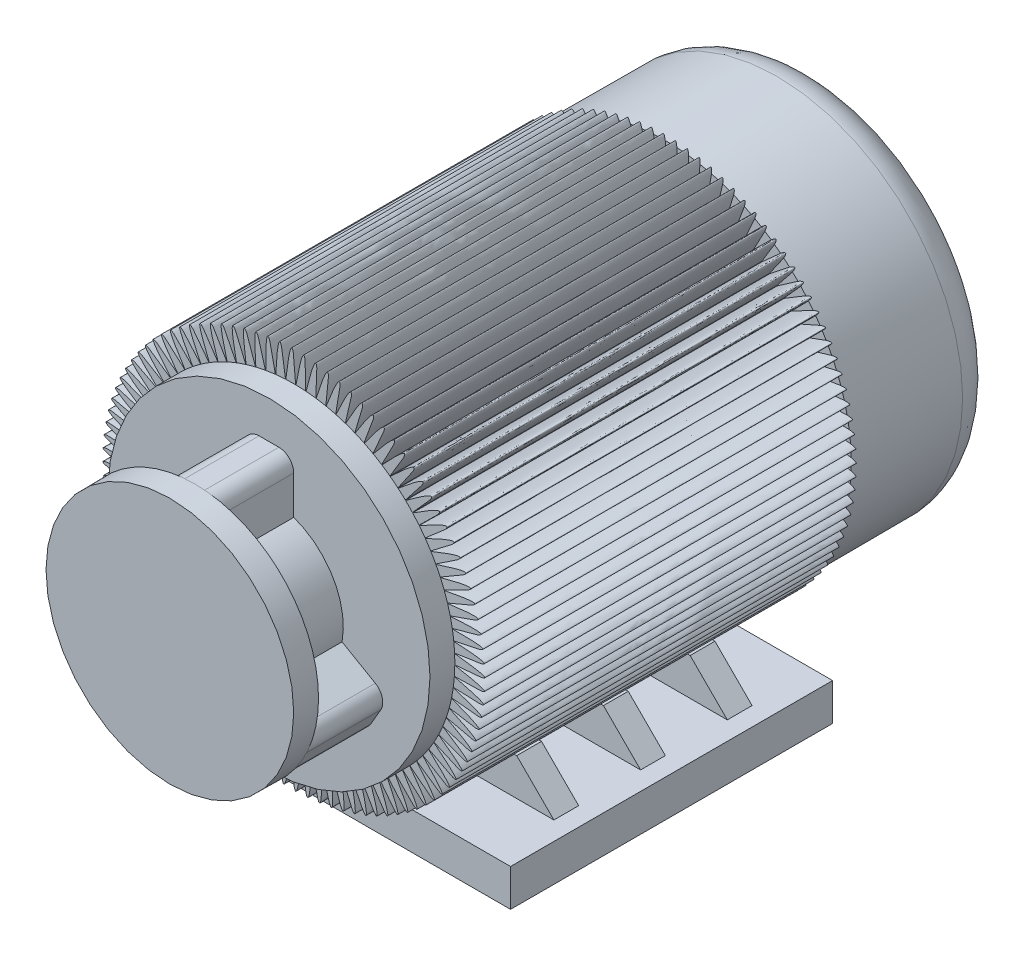
from build123d import *
from build123d.topology import SkipClean

# Parameters (mm, degrees)
SKETCH_1_R          = 75
EXTRUDE_1_DEPTH     = 60
EXTRUDE_3_DEPTH     = 150
FILLET_2_R          = 15
SKETCH_3_R          = 65
EXTRUDE_4_DEPTH     = 10
EXTRUDE_5_DEPTH     = 30
SKETCH_5_R          = 50
EXTRUDE_6_DEPTH     = 10
SKETCH_6_W          = 155
SKETCH_6_H          = 130
EXTRUDE_7_DEPTH     = 15
SKETCH_7_W          = 10
SKETCH_7_H          = 15
EXTRUDE_8_DEPTH     = 70
CUT_EXTRUDE_1_DEPTH = 85


with BuildPart() as part:
    # 草图1 → 凸台-拉伸1 (new body)
    with BuildSketch(Plane.XY):
        Circle(SKETCH_1_R)
    extrude(amount=EXTRUDE_1_DEPTH)

    # 草图2 → 凸台-拉伸3 (add)
    with BuildSketch(Plane.XY.offset(60)):
        with BuildLine():
            ThreePointArc((4.969560639, 64.809748241), (4.904456495, 64.814707486), (4.839347403, 64.819601331))
            add(Edge.make_bspline(
                [(0.890316583, 64.993902302), (5.231528677, 89.050972108), (4.839347403, 64.819601331)],
                knots=[0, 0, 0, 1, 1, 1], degree=2))
            ThreePointArc((0.890316583, 64.993902302), (0.825029514, 64.994763838), (0.759741613, 64.995559792))
            add(Edge.make_bspline(
                [(-3.192441145, 64.921555123), (-0.370351353, 89.203740759), (0.759741613, 64.995559792)],
                knots=[0, 0, 0, 1, 1, 1], degree=2))
            ThreePointArc((-3.192441145, 64.921555123), (-3.257653481, 64.91831555), (-3.32286253, 64.915010472))
            add(Edge.make_bspline(
                [(-7.262599766, 64.592992225), (-5.970769775, 89.004463), (-3.32286253, 64.915010472)],
                knots=[0, 0, 0, 1, 1, 1], degree=2))
            ThreePointArc((-7.262599766, 64.592992225), (-7.327480006, 64.585664329), (-7.392352853, 64.578271263))
            add(Edge.make_bspline(
                [(-11.304096224, 64.009510298), (-11.547624297, 88.453925287), (-7.392352853, 64.578271263)],
                knots=[0, 0, 0, 1, 1, 1], degree=2))
            ThreePointArc((-11.304096224, 64.009510298), (-11.368388316, 63.998122997), (-11.432668936, 63.98667112))
            add(Edge.make_bspline(
                [(-15.300980579, 63.173412076), (-17.078905622, 87.554300342), (-11.432668936, 63.98667112)],
                knots=[0, 0, 0, 1, 1, 1], degree=2))
            ThreePointArc((-15.300980579, 63.173412076), (-15.36443079, 63.158010311), (-15.427865498, 63.142544819))
            add(Edge.make_bspline(
                [(-19.237478954, 62.087997258), (-22.542784308, 86.309138573), (-15.427865498, 63.142544819)],
                knots=[0, 0, 0, 1, 1, 1], degree=2))
            ThreePointArc((-19.237478954, 62.087997258), (-19.299836875, 62.068641814), (-19.362175323, 62.04922374))
            add(Edge.make_bspline(
                [(-23.098055788, 60.75754948), (-27.917696924, 84.723354065), (-19.362175323, 62.04922374)],
                knots=[0, 0, 0, 1, 1, 1], degree=2))
            ThreePointArc((-23.098055788, 60.75754948), (-23.159075322, 60.734316743), (-23.220071488, 60.711022723))
            add(Edge.make_bspline(
                [(-26.867475148, 59.187319412), (-33.182431144, 82.803205185), (-23.220071488, 60.711022723)],
                knots=[0, 0, 0, 1, 1, 1], degree=2))
            ThreePointArc((-26.867475148, 59.187319412), (-26.926915478, 59.160301071), (-26.986328639, 59.133223036))
            add(Edge.make_bspline(
                [(-30.530860859, 57.383504034), (-38.316209469, 80.556269884), (-26.986328639, 59.133223036)],
                knots=[0, 0, 0, 1, 1, 1], degree=2))
            ThreePointArc((-30.530860859, 57.383504034), (-30.588487401, 57.352806719), (-30.646083079, 57.322051532))
            add(Edge.make_bspline(
                [(-34.07375521, 55.353222182), (-43.298771219, 77.991415787), (-30.646083079, 57.322051532)],
                knots=[0, 0, 0, 1, 1, 1], degree=2))
            ThreePointArc((-34.07375521, 55.353222182), (-34.129340539, 55.31896704), (-34.184891431, 55.28465608))
            add(Edge.make_bspline(
                [(-37.482176015, 53.10448645), (-48.110452501, 75.118765204), (-34.184891431, 55.28465608)],
                knots=[0, 0, 0, 1, 1, 1], degree=2))
            ThreePointArc((-37.482176015, 53.10448645), (-37.535500762, 53.066808671), (-37.588787634, 53.029077346))
            add(Edge.make_bspline(
                [(-40.742671797, 50.646171572), (-52.732263806, 71.949655173), (-37.588787634, 53.029077346)],
                knots=[0, 0, 0, 1, 1, 1], degree=2))
            ThreePointArc((-40.742671797, 50.646171572), (-40.793525512, 50.605219853), (-40.844338065, 50.564217072))
            add(Edge.make_bspline(
                [(-43.842374866, 47.987979392), (-57.145964957, 68.496592723), (-40.844338065, 50.564217072)],
                knots=[0, 0, 0, 1, 1, 1], degree=2))
            ThreePointArc((-43.842374866, 47.987979392), (-43.890556853, 47.943915351), (-43.938694553, 47.899802933))
            add(Edge.make_bspline(
                [(-46.769052111, 45.140400581), (-61.334137092, 64.773205515), (-43.938694553, 47.899802933)],
                knots=[0, 0, 0, 1, 1, 1], degree=2))
            ThreePointArc((-46.769052111, 45.140400581), (-46.814372218, 45.093398118), (-46.859645088, 45.046350155))
            add(Edge.make_bspline(
                [(-49.511153274, 42.114673232), (-65.280251409, 60.794188057), (-46.859645088, 45.046350155)],
                knots=[0, 0, 0, 1, 1, 1], degree=2))
            ThreePointArc((-49.511153274, 42.114673232), (-49.553432643, 42.064917845), (-49.595662011, 42.015120013))
            add(Edge.make_bspline(
                [(-52.057856535, 38.922738508), (-68.968734397, 56.575243713), (-49.595662011, 42.015120013)],
                knots=[0, 0, 0, 1, 1, 1], degree=2))
            ThreePointArc((-52.057856535, 38.922738508), (-52.096928309, 38.870426558), (-52.135947515, 38.818075387))
            add(Edge.make_bspline(
                [(-54.399111219, 35.577193517), (-72.3850293, 52.133022729), (-52.135947515, 38.818075387)],
                knots=[0, 0, 0, 1, 1, 1], degree=2))
            ThreePointArc((-54.399111219, 35.577193517), (-54.434821199, 35.522531456), (-54.470476253, 35.467833551))
            add(Edge.make_bspline(
                [(-56.525677464, 32.091241597), (-75.515653561, 47.485056522), (-54.470476253, 35.467833551)],
                knots=[0, 0, 0, 1, 1, 1], degree=2))
            ThreePointArc((-56.525677464, 32.091241597), (-56.557884719, 32.034445151), (-56.590034905, 31.977616381))
            add(Edge.make_bspline(
                [(-58.429162684, 28.478640208), (-78.348252037, 42.64968849), (-56.590034905, 31.977616381)],
                knots=[0, 0, 0, 1, 1, 1], degree=2))
            ThreePointArc((-58.429162684, 28.478640208), (-58.457740107, 28.419933526), (-58.486258544, 28.361198168))
            add(Edge.make_bspline(
                [(-60.102054692, 24.753646636), (-80.871645757, 37.646001622), (-58.486258544, 28.361198168)],
                knots=[0, 0, 0, 1, 1, 1], degree=2))
            ThreePointArc((-60.102054692, 24.753646636), (-60.126889501, 24.693261407), (-60.15166364, 24.632851262))
            add(Edge.make_bspline(
                [(-61.537751349, 20.93096173), (-83.075876038, 32.493743185), (-60.15166364, 24.632851262)],
                knots=[0, 0, 0, 1, 1, 1], degree=2))
            ThreePointArc((-61.537751349, 20.93096173), (-61.558745532, 20.869136267), (-61.579677601, 20.807289746))
            add(Edge.make_bspline(
                [(-62.730586615, 17.025671881), (-84.952243789, 27.213246789), (-61.579677601, 20.807289746)],
                knots=[0, 0, 0, 1, 1, 1], degree=2))
            ThreePointArc((-62.730586615, 17.025671881), (-62.747657318, 16.96265018), (-62.764664707, 16.899611364))
            add(Edge.make_bspline(
                [(-63.675852914, 13.053189482), (-86.493343846, 21.82535214), (-62.764664707, 16.899611364)],
                knots=[0, 0, 0, 1, 1, 1], degree=2))
            ThreePointArc((-63.675852914, 13.053189482), (-63.688932767, 12.989220263), (-63.701948355, 12.925237936))
            add(Edge.make_bspline(
                [(-64.369819713, 9.029192109), (-87.693094189, 16.351322797), (-63.701948355, 12.925237936)],
                knots=[0, 0, 0, 1, 1, 1], degree=2))
            ThreePointArc((-64.369819713, 9.029192109), (-64.378857095, 8.964527827), (-64.387829517, 8.8998545))
            add(Edge.make_bspline(
                [(-64.809748241, 4.969560639), (-88.546759952, 10.812762253), (-64.387829517, 8.8998545)],
                knots=[0, 0, 0, 1, 1, 1], degree=2))
            ThreePointArc((-64.809748241, 4.969560639), (-64.814707486, 4.904456495), (-64.819601331, 4.839347403))
            add(Edge.make_bspline(
                [(-64.993902302, 0.890316583), (-89.050972108, 5.231528677), (-64.819601331, 4.839347403)],
                knots=[0, 0, 0, 1, 1, 1], degree=2))
            ThreePointArc((-64.993902302, 0.890316583), (-64.994763838, 0.825029514), (-64.995559792, 0.759741613))
            add(Edge.make_bspline(
                [(-64.921555123, -3.192441145), (-89.203740759, -0.370351353), (-64.995559792, 0.759741613)],
                knots=[0, 0, 0, 1, 1, 1], degree=2))
            ThreePointArc((-64.921555123, -3.192441145), (-64.91831555, -3.257653481), (-64.915010472, -3.32286253))
            add(Edge.make_bspline(
                [(-64.592992225, -7.262599766), (-89.004463, -5.970769775), (-64.915010472, -3.32286253)],
                knots=[0, 0, 0, 1, 1, 1], degree=2))
            ThreePointArc((-64.592992225, -7.262599766), (-64.585664329, -7.327480006), (-64.578271263, -7.392352853))
            add(Edge.make_bspline(
                [(-64.009510298, -11.304096224), (-88.453925287, -11.547624297), (-64.578271263, -7.392352853)],
                knots=[0, 0, 0, 1, 1, 1], degree=2))
            ThreePointArc((-64.009510298, -11.304096224), (-63.998122997, -11.368388316), (-63.98667112, -11.432668936))
            add(Edge.make_bspline(
                [(-63.173412076, -15.300980579), (-87.554300342, -17.078905622), (-63.98667112, -11.432668936)],
                knots=[0, 0, 0, 1, 1, 1], degree=2))
            ThreePointArc((-63.173412076, -15.300980579), (-63.158010311, -15.36443079), (-63.142544819, -15.427865498))
            add(Edge.make_bspline(
                [(-62.087997258, -19.237478954), (-86.309138573, -22.542784308), (-63.142544819, -15.427865498)],
                knots=[0, 0, 0, 1, 1, 1], degree=2))
            ThreePointArc((-62.087997258, -19.237478954), (-62.068641814, -19.299836875), (-62.04922374, -19.362175323))
            add(Edge.make_bspline(
                [(-60.75754948, -23.098055788), (-84.723354065, -27.917696924), (-62.04922374, -19.362175323)],
                knots=[0, 0, 0, 1, 1, 1], degree=2))
            ThreePointArc((-60.75754948, -23.098055788), (-60.734316743, -23.159075322), (-60.711022723, -23.220071488))
            add(Edge.make_bspline(
                [(-59.187319412, -26.867475148), (-82.803205185, -33.182431144), (-60.711022723, -23.220071488)],
                knots=[0, 0, 0, 1, 1, 1], degree=2))
            ThreePointArc((-59.187319412, -26.867475148), (-59.160301071, -26.926915478), (-59.133223036, -26.986328639))
            add(Edge.make_bspline(
                [(-57.383504034, -30.530860859), (-80.556269884, -38.316209469), (-59.133223036, -26.986328639)],
                knots=[0, 0, 0, 1, 1, 1], degree=2))
            ThreePointArc((-57.383504034, -30.530860859), (-57.352806719, -30.588487401), (-57.322051532, -30.646083079))
            add(Edge.make_bspline(
                [(-55.353222182, -34.07375521), (-77.991415787, -43.298771219), (-57.322051532, -30.646083079)],
                knots=[0, 0, 0, 1, 1, 1], degree=2))
            ThreePointArc((-55.353222182, -34.07375521), (-55.31896704, -34.129340539), (-55.28465608, -34.184891431))
            add(Edge.make_bspline(
                [(-53.10448645, -37.482176015), (-75.118765204, -48.110452501), (-55.28465608, -34.184891431)],
                knots=[0, 0, 0, 1, 1, 1], degree=2))
            ThreePointArc((-53.10448645, -37.482176015), (-53.066808671, -37.535500762), (-53.029077346, -37.588787634))
            add(Edge.make_bspline(
                [(-50.646171572, -40.742671797), (-71.949655173, -52.732263806), (-53.029077346, -37.588787634)],
                knots=[0, 0, 0, 1, 1, 1], degree=2))
            ThreePointArc((-50.646171572, -40.742671797), (-50.605219853, -40.793525512), (-50.564217072, -40.844338065))
            add(Edge.make_bspline(
                [(-47.987979392, -43.842374866), (-68.496592723, -57.145964957), (-50.564217072, -40.844338065)],
                knots=[0, 0, 0, 1, 1, 1], degree=2))
            ThreePointArc((-47.987979392, -43.842374866), (-47.943915351, -43.890556853), (-47.899802933, -43.938694553))
            add(Edge.make_bspline(
                [(-45.140400581, -46.769052111), (-64.773205515, -61.334137092), (-47.899802933, -43.938694553)],
                knots=[0, 0, 0, 1, 1, 1], degree=2))
            ThreePointArc((-45.140400581, -46.769052111), (-45.093398118, -46.814372218), (-45.046350155, -46.859645088))
            add(Edge.make_bspline(
                [(-42.114673232, -49.511153274), (-60.794188057, -65.280251409), (-45.046350155, -46.859645088)],
                knots=[0, 0, 0, 1, 1, 1], degree=2))
            ThreePointArc((-42.114673232, -49.511153274), (-42.064917845, -49.553432643), (-42.015120013, -49.595662011))
            add(Edge.make_bspline(
                [(-38.922738508, -52.057856535), (-56.575243713, -68.968734397), (-42.015120013, -49.595662011)],
                knots=[0, 0, 0, 1, 1, 1], degree=2))
            ThreePointArc((-38.922738508, -52.057856535), (-38.870426558, -52.096928309), (-38.818075387, -52.135947515))
            add(Edge.make_bspline(
                [(-35.577193517, -54.399111219), (-52.133022729, -72.3850293), (-38.818075387, -52.135947515)],
                knots=[0, 0, 0, 1, 1, 1], degree=2))
            ThreePointArc((-35.577193517, -54.399111219), (-35.522531456, -54.434821199), (-35.467833551, -54.470476253))
            add(Edge.make_bspline(
                [(-32.091241597, -56.525677464), (-47.485056522, -75.515653561), (-35.467833551, -54.470476253)],
                knots=[0, 0, 0, 1, 1, 1], degree=2))
            ThreePointArc((-32.091241597, -56.525677464), (-32.034445151, -56.557884719), (-31.977616381, -56.590034905))
            add(Edge.make_bspline(
                [(-28.478640208, -58.429162684), (-42.64968849, -78.348252037), (-31.977616381, -56.590034905)],
                knots=[0, 0, 0, 1, 1, 1], degree=2))
            ThreePointArc((-28.478640208, -58.429162684), (-28.419933526, -58.457740107), (-28.361198168, -58.486258544))
            add(Edge.make_bspline(
                [(-24.753646636, -60.102054692), (-37.646001622, -80.871645757), (-28.361198168, -58.486258544)],
                knots=[0, 0, 0, 1, 1, 1], degree=2))
            ThreePointArc((-24.753646636, -60.102054692), (-24.693261407, -60.126889501), (-24.632851262, -60.15166364))
            add(Edge.make_bspline(
                [(-20.93096173, -61.537751349), (-32.493743185, -83.075876038), (-24.632851262, -60.15166364)],
                knots=[0, 0, 0, 1, 1, 1], degree=2))
            ThreePointArc((-20.93096173, -61.537751349), (-20.869136267, -61.558745532), (-20.807289746, -61.579677601))
            add(Edge.make_bspline(
                [(-17.025671881, -62.730586615), (-27.213246789, -84.952243789), (-20.807289746, -61.579677601)],
                knots=[0, 0, 0, 1, 1, 1], degree=2))
            ThreePointArc((-17.025671881, -62.730586615), (-16.96265018, -62.747657318), (-16.899611364, -62.764664707))
            add(Edge.make_bspline(
                [(-13.053189482, -63.675852914), (-21.82535214, -86.493343846), (-16.899611364, -62.764664707)],
                knots=[0, 0, 0, 1, 1, 1], degree=2))
            ThreePointArc((-13.053189482, -63.675852914), (-12.989220263, -63.688932767), (-12.925237936, -63.701948355))
            add(Edge.make_bspline(
                [(-9.029192109, -64.369819713), (-16.351322797, -87.693094189), (-12.925237936, -63.701948355)],
                knots=[0, 0, 0, 1, 1, 1], degree=2))
            ThreePointArc((-9.029192109, -64.369819713), (-8.964527827, -64.378857095), (-8.8998545, -64.387829517))
            add(Edge.make_bspline(
                [(-4.969560639, -64.809748241), (-10.812762253, -88.546759952), (-8.8998545, -64.387829517)],
                knots=[0, 0, 0, 1, 1, 1], degree=2))
            ThreePointArc((-4.969560639, -64.809748241), (-4.904456495, -64.814707486), (-4.839347403, -64.819601331))
            add(Edge.make_bspline(
                [(-0.890316583, -64.993902302), (-5.231528677, -89.050972108), (-4.839347403, -64.819601331)],
                knots=[0, 0, 0, 1, 1, 1], degree=2))
            ThreePointArc((-0.890316583, -64.993902302), (-0.825029514, -64.994763838), (-0.759741613, -64.995559792))
            add(Edge.make_bspline(
                [(3.192441145, -64.921555123), (0.370351353, -89.203740759), (-0.759741613, -64.995559792)],
                knots=[0, 0, 0, 1, 1, 1], degree=2))
            ThreePointArc((3.192441145, -64.921555123), (3.257653481, -64.91831555), (3.32286253, -64.915010472))
            add(Edge.make_bspline(
                [(7.262599766, -64.592992225), (5.970769775, -89.004463), (3.32286253, -64.915010472)],
                knots=[0, 0, 0, 1, 1, 1], degree=2))
            ThreePointArc((7.262599766, -64.592992225), (7.327480006, -64.585664329), (7.392352853, -64.578271263))
            add(Edge.make_bspline(
                [(11.304096224, -64.009510298), (11.547624297, -88.453925287), (7.392352853, -64.578271263)],
                knots=[0, 0, 0, 1, 1, 1], degree=2))
            ThreePointArc((11.304096224, -64.009510298), (11.368388316, -63.998122997), (11.432668936, -63.98667112))
            add(Edge.make_bspline(
                [(15.300980579, -63.173412076), (17.078905622, -87.554300342), (11.432668936, -63.98667112)],
                knots=[0, 0, 0, 1, 1, 1], degree=2))
            ThreePointArc((15.300980579, -63.173412076), (15.36443079, -63.158010311), (15.427865498, -63.142544819))
            add(Edge.make_bspline(
                [(19.237478954, -62.087997258), (22.542784308, -86.309138573), (15.427865498, -63.142544819)],
                knots=[0, 0, 0, 1, 1, 1], degree=2))
            ThreePointArc((19.237478954, -62.087997258), (19.299836875, -62.068641814), (19.362175323, -62.04922374))
            add(Edge.make_bspline(
                [(23.098055788, -60.75754948), (27.917696924, -84.723354065), (19.362175323, -62.04922374)],
                knots=[0, 0, 0, 1, 1, 1], degree=2))
            ThreePointArc((23.098055788, -60.75754948), (23.159075322, -60.734316743), (23.220071488, -60.711022723))
            add(Edge.make_bspline(
                [(26.867475148, -59.187319412), (33.182431144, -82.803205185), (23.220071488, -60.711022723)],
                knots=[0, 0, 0, 1, 1, 1], degree=2))
            ThreePointArc((26.867475148, -59.187319412), (26.926915478, -59.160301071), (26.986328639, -59.133223036))
            add(Edge.make_bspline(
                [(30.530860859, -57.383504034), (38.316209469, -80.556269884), (26.986328639, -59.133223036)],
                knots=[0, 0, 0, 1, 1, 1], degree=2))
            ThreePointArc((30.530860859, -57.383504034), (30.588487401, -57.352806719), (30.646083079, -57.322051532))
            add(Edge.make_bspline(
                [(34.07375521, -55.353222182), (43.298771219, -77.991415787), (30.646083079, -57.322051532)],
                knots=[0, 0, 0, 1, 1, 1], degree=2))
            ThreePointArc((34.07375521, -55.353222182), (34.129340539, -55.31896704), (34.184891431, -55.28465608))
            add(Edge.make_bspline(
                [(37.482176015, -53.10448645), (48.110452501, -75.118765204), (34.184891431, -55.28465608)],
                knots=[0, 0, 0, 1, 1, 1], degree=2))
            ThreePointArc((37.482176015, -53.10448645), (37.535500762, -53.066808671), (37.588787634, -53.029077346))
            add(Edge.make_bspline(
                [(40.742671797, -50.646171572), (52.732263806, -71.949655173), (37.588787634, -53.029077346)],
                knots=[0, 0, 0, 1, 1, 1], degree=2))
            ThreePointArc((40.742671797, -50.646171572), (40.793525512, -50.605219853), (40.844338065, -50.564217072))
            add(Edge.make_bspline(
                [(43.842374866, -47.987979392), (57.145964957, -68.496592723), (40.844338065, -50.564217072)],
                knots=[0, 0, 0, 1, 1, 1], degree=2))
            ThreePointArc((43.842374866, -47.987979392), (43.890556853, -47.943915351), (43.938694553, -47.899802933))
            add(Edge.make_bspline(
                [(46.769052111, -45.140400581), (61.334137092, -64.773205515), (43.938694553, -47.899802933)],
                knots=[0, 0, 0, 1, 1, 1], degree=2))
            ThreePointArc((46.769052111, -45.140400581), (46.814372218, -45.093398118), (46.859645088, -45.046350155))
            add(Edge.make_bspline(
                [(49.511153274, -42.114673232), (65.280251409, -60.794188057), (46.859645088, -45.046350155)],
                knots=[0, 0, 0, 1, 1, 1], degree=2))
            ThreePointArc((49.511153274, -42.114673232), (49.553432643, -42.064917845), (49.595662011, -42.015120013))
            add(Edge.make_bspline(
                [(52.057856535, -38.922738508), (68.968734397, -56.575243713), (49.595662011, -42.015120013)],
                knots=[0, 0, 0, 1, 1, 1], degree=2))
            ThreePointArc((52.057856535, -38.922738508), (52.096928309, -38.870426558), (52.135947515, -38.818075387))
            add(Edge.make_bspline(
                [(54.399111219, -35.577193517), (72.3850293, -52.133022729), (52.135947515, -38.818075387)],
                knots=[0, 0, 0, 1, 1, 1], degree=2))
            ThreePointArc((54.399111219, -35.577193517), (54.434821199, -35.522531456), (54.470476253, -35.467833551))
            add(Edge.make_bspline(
                [(56.525677464, -32.091241597), (75.515653561, -47.485056522), (54.470476253, -35.467833551)],
                knots=[0, 0, 0, 1, 1, 1], degree=2))
            ThreePointArc((56.525677464, -32.091241597), (56.557884719, -32.034445151), (56.590034905, -31.977616381))
            add(Edge.make_bspline(
                [(58.429162684, -28.478640208), (78.348252037, -42.64968849), (56.590034905, -31.977616381)],
                knots=[0, 0, 0, 1, 1, 1], degree=2))
            ThreePointArc((58.429162684, -28.478640208), (58.457740107, -28.419933526), (58.486258544, -28.361198168))
            add(Edge.make_bspline(
                [(60.102054692, -24.753646636), (80.871645757, -37.646001622), (58.486258544, -28.361198168)],
                knots=[0, 0, 0, 1, 1, 1], degree=2))
            ThreePointArc((60.102054692, -24.753646636), (60.126889501, -24.693261407), (60.15166364, -24.632851262))
            add(Edge.make_bspline(
                [(61.537751349, -20.93096173), (83.075876038, -32.493743185), (60.15166364, -24.632851262)],
                knots=[0, 0, 0, 1, 1, 1], degree=2))
            ThreePointArc((61.537751349, -20.93096173), (61.558745532, -20.869136267), (61.579677601, -20.807289746))
            add(Edge.make_bspline(
                [(62.730586615, -17.025671881), (84.952243789, -27.213246789), (61.579677601, -20.807289746)],
                knots=[0, 0, 0, 1, 1, 1], degree=2))
            ThreePointArc((62.730586615, -17.025671881), (62.747657318, -16.96265018), (62.764664707, -16.899611364))
            add(Edge.make_bspline(
                [(63.675852914, -13.053189482), (86.493343846, -21.82535214), (62.764664707, -16.899611364)],
                knots=[0, 0, 0, 1, 1, 1], degree=2))
            ThreePointArc((63.675852914, -13.053189482), (63.688932767, -12.989220263), (63.701948355, -12.925237936))
            add(Edge.make_bspline(
                [(64.369819713, -9.029192109), (87.693094189, -16.351322797), (63.701948355, -12.925237936)],
                knots=[0, 0, 0, 1, 1, 1], degree=2))
            ThreePointArc((64.369819713, -9.029192109), (64.378857095, -8.964527827), (64.387829517, -8.8998545))
            add(Edge.make_bspline(
                [(64.809748241, -4.969560639), (88.546759952, -10.812762253), (64.387829517, -8.8998545)],
                knots=[0, 0, 0, 1, 1, 1], degree=2))
            ThreePointArc((64.809748241, -4.969560639), (64.814707486, -4.904456495), (64.819601331, -4.839347403))
            add(Edge.make_bspline(
                [(64.993902302, -0.890316583), (89.050972108, -5.231528677), (64.819601331, -4.839347403)],
                knots=[0, 0, 0, 1, 1, 1], degree=2))
            ThreePointArc((64.993902302, -0.890316583), (64.994763838, -0.825029514), (64.995559792, -0.759741613))
            add(Edge.make_bspline(
                [(64.921555123, 3.192441145), (89.203740759, 0.370351353), (64.995559792, -0.759741613)],
                knots=[0, 0, 0, 1, 1, 1], degree=2))
            ThreePointArc((64.921555123, 3.192441145), (64.91831555, 3.257653481), (64.915010472, 3.32286253))
            add(Edge.make_bspline(
                [(64.592992225, 7.262599766), (89.004463, 5.970769775), (64.915010472, 3.32286253)],
                knots=[0, 0, 0, 1, 1, 1], degree=2))
            ThreePointArc((64.592992225, 7.262599766), (64.585664329, 7.327480006), (64.578271263, 7.392352853))
            add(Edge.make_bspline(
                [(64.009510298, 11.304096224), (88.453925287, 11.547624297), (64.578271263, 7.392352853)],
                knots=[0, 0, 0, 1, 1, 1], degree=2))
            ThreePointArc((64.009510298, 11.304096224), (63.998122997, 11.368388316), (63.98667112, 11.432668936))
            add(Edge.make_bspline(
                [(63.173412076, 15.300980579), (87.554300342, 17.078905622), (63.98667112, 11.432668936)],
                knots=[0, 0, 0, 1, 1, 1], degree=2))
            ThreePointArc((63.173412076, 15.300980579), (63.158010311, 15.36443079), (63.142544819, 15.427865498))
            add(Edge.make_bspline(
                [(62.087997258, 19.237478954), (86.309138573, 22.542784308), (63.142544819, 15.427865498)],
                knots=[0, 0, 0, 1, 1, 1], degree=2))
            ThreePointArc((62.087997258, 19.237478954), (62.068641814, 19.299836875), (62.04922374, 19.362175323))
            add(Edge.make_bspline(
                [(60.75754948, 23.098055788), (84.723354065, 27.917696924), (62.04922374, 19.362175323)],
                knots=[0, 0, 0, 1, 1, 1], degree=2))
            ThreePointArc((60.75754948, 23.098055788), (60.734316743, 23.159075322), (60.711022723, 23.220071488))
            add(Edge.make_bspline(
                [(59.187319412, 26.867475148), (82.803205185, 33.182431144), (60.711022723, 23.220071488)],
                knots=[0, 0, 0, 1, 1, 1], degree=2))
            ThreePointArc((59.187319412, 26.867475148), (59.160301071, 26.926915478), (59.133223036, 26.986328639))
            add(Edge.make_bspline(
                [(57.383504034, 30.530860859), (80.556269884, 38.316209469), (59.133223036, 26.986328639)],
                knots=[0, 0, 0, 1, 1, 1], degree=2))
            ThreePointArc((57.383504034, 30.530860859), (57.352806719, 30.588487401), (57.322051532, 30.646083079))
            add(Edge.make_bspline(
                [(55.353222182, 34.07375521), (77.991415787, 43.298771219), (57.322051532, 30.646083079)],
                knots=[0, 0, 0, 1, 1, 1], degree=2))
            ThreePointArc((55.353222182, 34.07375521), (55.31896704, 34.129340539), (55.28465608, 34.184891431))
            add(Edge.make_bspline(
                [(53.10448645, 37.482176015), (75.118765204, 48.110452501), (55.28465608, 34.184891431)],
                knots=[0, 0, 0, 1, 1, 1], degree=2))
            ThreePointArc((53.10448645, 37.482176015), (53.066808671, 37.535500762), (53.029077346, 37.588787634))
            add(Edge.make_bspline(
                [(50.646171572, 40.742671797), (71.949655173, 52.732263806), (53.029077346, 37.588787634)],
                knots=[0, 0, 0, 1, 1, 1], degree=2))
            ThreePointArc((50.646171572, 40.742671797), (50.605219853, 40.793525512), (50.564217072, 40.844338065))
            add(Edge.make_bspline(
                [(47.987979392, 43.842374866), (68.496592723, 57.145964957), (50.564217072, 40.844338065)],
                knots=[0, 0, 0, 1, 1, 1], degree=2))
            ThreePointArc((47.987979392, 43.842374866), (47.943915351, 43.890556853), (47.899802933, 43.938694553))
            add(Edge.make_bspline(
                [(45.140400581, 46.769052111), (64.773205515, 61.334137092), (47.899802933, 43.938694553)],
                knots=[0, 0, 0, 1, 1, 1], degree=2))
            ThreePointArc((45.140400581, 46.769052111), (45.093398118, 46.814372218), (45.046350155, 46.859645088))
            add(Edge.make_bspline(
                [(42.114673232, 49.511153274), (60.794188057, 65.280251409), (45.046350155, 46.859645088)],
                knots=[0, 0, 0, 1, 1, 1], degree=2))
            ThreePointArc((42.114673232, 49.511153274), (42.064917845, 49.553432643), (42.015120013, 49.595662011))
            add(Edge.make_bspline(
                [(38.922738508, 52.057856535), (56.575243713, 68.968734397), (42.015120013, 49.595662011)],
                knots=[0, 0, 0, 1, 1, 1], degree=2))
            ThreePointArc((38.922738508, 52.057856535), (38.870426558, 52.096928309), (38.818075387, 52.135947515))
            add(Edge.make_bspline(
                [(35.577193517, 54.399111219), (52.133022729, 72.3850293), (38.818075387, 52.135947515)],
                knots=[0, 0, 0, 1, 1, 1], degree=2))
            ThreePointArc((35.577193517, 54.399111219), (35.522531456, 54.434821199), (35.467833551, 54.470476253))
            add(Edge.make_bspline(
                [(32.091241597, 56.525677464), (47.485056522, 75.515653561), (35.467833551, 54.470476253)],
                knots=[0, 0, 0, 1, 1, 1], degree=2))
            ThreePointArc((32.091241597, 56.525677464), (32.034445151, 56.557884719), (31.977616381, 56.590034905))
            add(Edge.make_bspline(
                [(28.478640208, 58.429162684), (42.64968849, 78.348252037), (31.977616381, 56.590034905)],
                knots=[0, 0, 0, 1, 1, 1], degree=2))
            ThreePointArc((28.478640208, 58.429162684), (28.419933526, 58.457740107), (28.361198168, 58.486258544))
            add(Edge.make_bspline(
                [(24.753646636, 60.102054692), (37.646001622, 80.871645757), (28.361198168, 58.486258544)],
                knots=[0, 0, 0, 1, 1, 1], degree=2))
            ThreePointArc((24.753646636, 60.102054692), (24.693261407, 60.126889501), (24.632851262, 60.15166364))
            add(Edge.make_bspline(
                [(20.93096173, 61.537751349), (32.493743185, 83.075876038), (24.632851262, 60.15166364)],
                knots=[0, 0, 0, 1, 1, 1], degree=2))
            ThreePointArc((20.93096173, 61.537751349), (20.869136267, 61.558745532), (20.807289746, 61.579677601))
            add(Edge.make_bspline(
                [(17.025671881, 62.730586615), (27.213246789, 84.952243789), (20.807289746, 61.579677601)],
                knots=[0, 0, 0, 1, 1, 1], degree=2))
            ThreePointArc((17.025671881, 62.730586615), (16.96265018, 62.747657318), (16.899611364, 62.764664707))
            add(Edge.make_bspline(
                [(13.053189482, 63.675852914), (21.82535214, 86.493343846), (16.899611364, 62.764664707)],
                knots=[0, 0, 0, 1, 1, 1], degree=2))
            ThreePointArc((13.053189482, 63.675852914), (12.989220263, 63.688932767), (12.925237936, 63.701948355))
            add(Edge.make_bspline(
                [(9.029192109, 64.369819713), (16.351322797, 87.693094189), (12.925237936, 63.701948355)],
                knots=[0, 0, 0, 1, 1, 1], degree=2))
            ThreePointArc((9.029192109, 64.369819713), (8.964527827, 64.378857095), (8.8998545, 64.387829517))
            add(Edge.make_bspline(
                [(4.969560639, 64.809748241), (10.812762253, 88.546759952), (8.8998545, 64.387829517)],
                knots=[0, 0, 0, 1, 1, 1], degree=2))
        make_face()
    extrude(amount=EXTRUDE_3_DEPTH)

    # 圆角2
    fillet_2_edges = [part.edges().sort_by_distance(p)[0] for p in [
        (-75, 0, 0),
    ]]
    fillet(fillet_2_edges, radius=FILLET_2_R)

    # 草图3 → 凸台-拉伸4 (add)
    with SkipClean():  # the faces are left unmerged after this step: merging them gives an invalid solid
        with BuildSketch(Plane.XY.offset(210)):
            with Locations(Location((0, 0, 0), (0, 0, 179.330292628))):
                Circle(SKETCH_3_R)
        extrude(amount=EXTRUDE_4_DEPTH)

    # 草图4 → 凸台-拉伸5 (add)
    with SkipClean():  # the faces are left unmerged after this step: merging them gives an invalid solid
        with BuildSketch(Plane.XY.offset(220)):
            with BuildLine():
                Line((-10, 28.284271247), (-10, 43.790913493))
                ThreePointArc((-10, 43.790913493), (-8.242640687, 48.03355418), (-4, 49.790913493))
                Line((-4, 49.790913493), (4, 49.790913493))
                ThreePointArc((4, 49.790913493), (8.242640687, 48.03355418), (10, 43.790913493))
                Line((10, 43.790913493), (10, 28.284271247))
                ThreePointArc((10, 28.284271247), (25.980762114, 15), (29.494897428, -5.481881586))
                Line((29.494897428, -5.481881586), (42.92404354, -13.235202709))
                ThreePointArc((42.92404354, -13.235202709), (45.719598498, -16.878440861), (45.120195963, -21.431355132))
                Line((45.120195963, -21.431355132), (41.120195963, -28.359558362))
                ThreePointArc((41.120195963, -28.359558362), (37.476957811, -31.15511332), (32.92404354, -30.555710784))
                Line((32.92404354, -30.555710784), (19.494897428, -22.802389662))
                ThreePointArc((19.494897428, -22.802389662), (0, -30), (-19.494897428, -22.802389662))
                Line((-19.494897428, -22.802389662), (-32.92404354, -30.555710784))
                ThreePointArc((-32.92404354, -30.555710784), (-37.476957811, -31.15511332), (-41.120195963, -28.359558362))
                Line((-41.120195963, -28.359558362), (-45.120195963, -21.431355132))
                ThreePointArc((-45.120195963, -21.431355132), (-45.719598498, -16.878440861), (-42.92404354, -13.235202709))
                Line((-42.92404354, -13.235202709), (-29.494897428, -5.481881586))
                ThreePointArc((-29.494897428, -5.481881586), (-25.980762114, 15), (-10, 28.284271247))
            make_face()
        extrude(amount=EXTRUDE_5_DEPTH)

    # 草图5 → 凸台-拉伸6 (add)
    with BuildSketch(Plane.XY.offset(250)):
        Circle(SKETCH_5_R)
    extrude(amount=EXTRUDE_6_DEPTH)

    # 草图6 → 凸台-拉伸7 (add)
    with BuildSketch(Plane(origin=(0, -85, 0), x_dir=(1, 0, 0), z_dir=(0, 1, 0))):
        with Locations((0, -135)):
            Rectangle(SKETCH_6_W, SKETCH_6_H)
    extrude(amount=EXTRUDE_7_DEPTH)

    # 草图7 → 凸台-拉伸8 (add)
    with BuildSketch(Plane(origin=(0, 0, 0), x_dir=(0, 0, -1), z_dir=(1, 0, 0))):
        with Locations((-170, -62.5)):
            Rectangle(SKETCH_7_W, SKETCH_7_H)
        with Locations((-135, -62.5)):
            Rectangle(SKETCH_7_W, SKETCH_7_H)
        with Locations((-100, -62.5)):
            Rectangle(SKETCH_7_W, SKETCH_7_H)
    extrude_8 = extrude(amount=EXTRUDE_8_DEPTH)

    # 草图8 → 切除-拉伸1 (cut)
    with BuildSketch(Plane.XY.offset(175)):
        Polygon((70, -55), (55, -55), (70, -70), align=None)
    cut_extrude_1 = extrude(amount=-CUT_EXTRUDE_1_DEPTH, mode=Mode.SUBTRACT)

    # 镜向1: 凸台-拉伸8, 切除-拉伸1 across plane
    add(extrude_8.mirror(Plane(origin=(0, 0, 0), x_dir=(0, 0, 1), z_dir=(1, 0, 0))))
    add(cut_extrude_1.mirror(Plane(origin=(0, 0, 0), x_dir=(0, 0, 1), z_dir=(1, 0, 0))), mode=Mode.SUBTRACT)


solid = part.part
